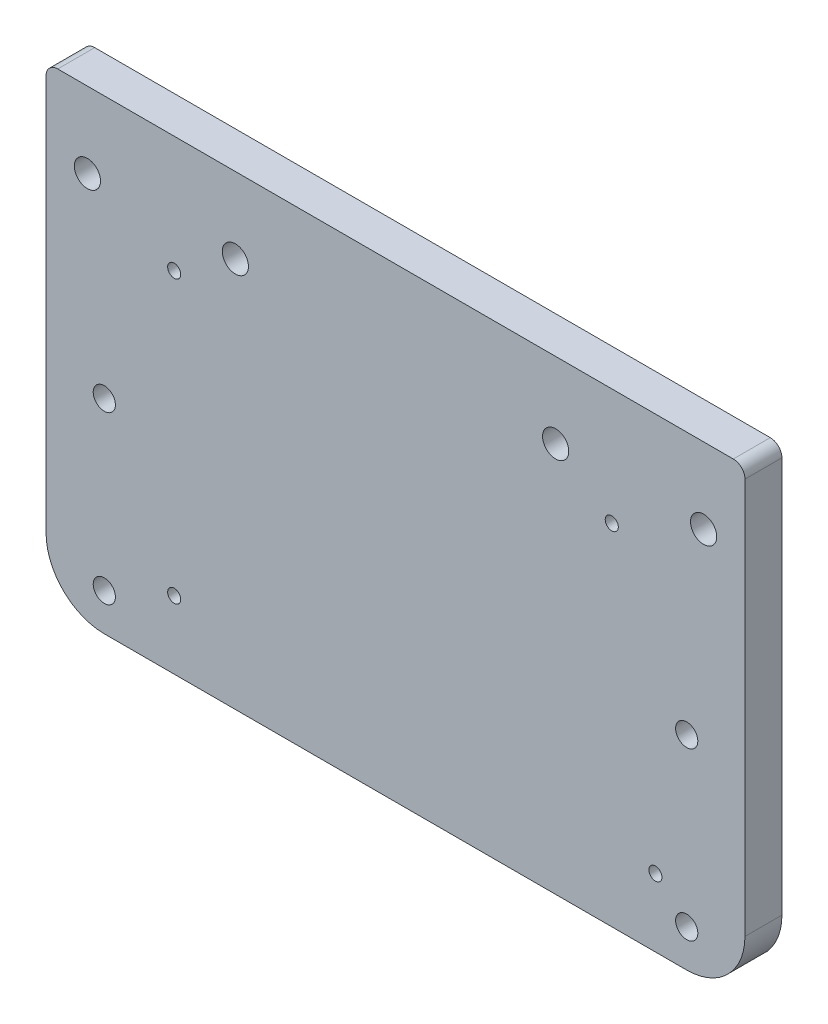
from build123d import *

# Parameters (mm, degrees)
SKETCH1_W           = 120
SKETCH1_H           = 80
BOSS_EXTRUDE1_DEPTH = 3.175
FILLET1_R           = 10
SKETCH2_R           = 2.25
CUT_EXTRUDE1_DEPTH  = 101.201409671
FILLET4_R           = 2
SKETCH7_R           = 1.905
CUT_EXTRUDE2_DEPTH  = 101.201409671
SKETCH8_R           = 1.125
CUT_EXTRUDE3_DEPTH  = 101.201409671


with BuildPart() as part:
    # Sketch1 → Boss-Extrude1 (new, symmetric)
    with BuildSketch(Plane.XY):
        with Locations((0, -40)):
            Rectangle(SKETCH1_W, SKETCH1_H)
    extrude(amount=BOSS_EXTRUDE1_DEPTH, both=True)

    # Fillet1
    fillet1_edges = [part.edges().sort_by_distance(p)[0] for p in [
        (60, -80, 0),
        (-60, -80, 0),
    ]]
    fillet(fillet1_edges, radius=FILLET1_R)

    # Sketch2 → Cut-Extrude1 (cut, through all)
    with BuildSketch(Plane.XY.offset(3.175)):
        with Locations((-52.9, -13)):
            Circle(SKETCH2_R)
        with Locations((-27.5, -13)):
            Circle(SKETCH2_R)
        with Locations((27.5, -13)):
            Circle(SKETCH2_R)
        with Locations((52.9, -13)):
            Circle(SKETCH2_R)
    extrude(amount=-CUT_EXTRUDE1_DEPTH, mode=Mode.SUBTRACT)

    # Fillet4
    fillet4_edges = [part.edges().sort_by_distance(p)[0] for p in [
        (-60, 0, 0),
        (60, 0, 0),
    ]]
    fillet(fillet4_edges, radius=FILLET4_R)

    # Sketch7 → Cut-Extrude2 (cut, through all)
    with BuildSketch(Plane.XY.offset(3.175)):
        with Locations((-50, -45)):
            Circle(SKETCH7_R)
        with Locations((-50, -73.575)):
            Circle(SKETCH7_R)
        with Locations((50, -73.575)):
            Circle(SKETCH7_R)
        with Locations((50, -45)):
            Circle(SKETCH7_R)
    extrude(amount=-CUT_EXTRUDE2_DEPTH, mode=Mode.SUBTRACT)

    # Sketch8 → Cut-Extrude3 (cut, through all)
    with BuildSketch(Plane(origin=(0, 0, -3.175), x_dir=(-1, 0, 0), z_dir=(0, 0, -1))):
        with Locations((-37.133, -20)):
            Circle(SKETCH8_R)
        with Locations((38, -20)):
            Circle(SKETCH8_R)
        with Locations((-44.626, -68.336)):
            Circle(SKETCH8_R)
        with Locations((38, -68.336)):
            Circle(SKETCH8_R)
    extrude(amount=-CUT_EXTRUDE3_DEPTH, mode=Mode.SUBTRACT)


solid = part.part
